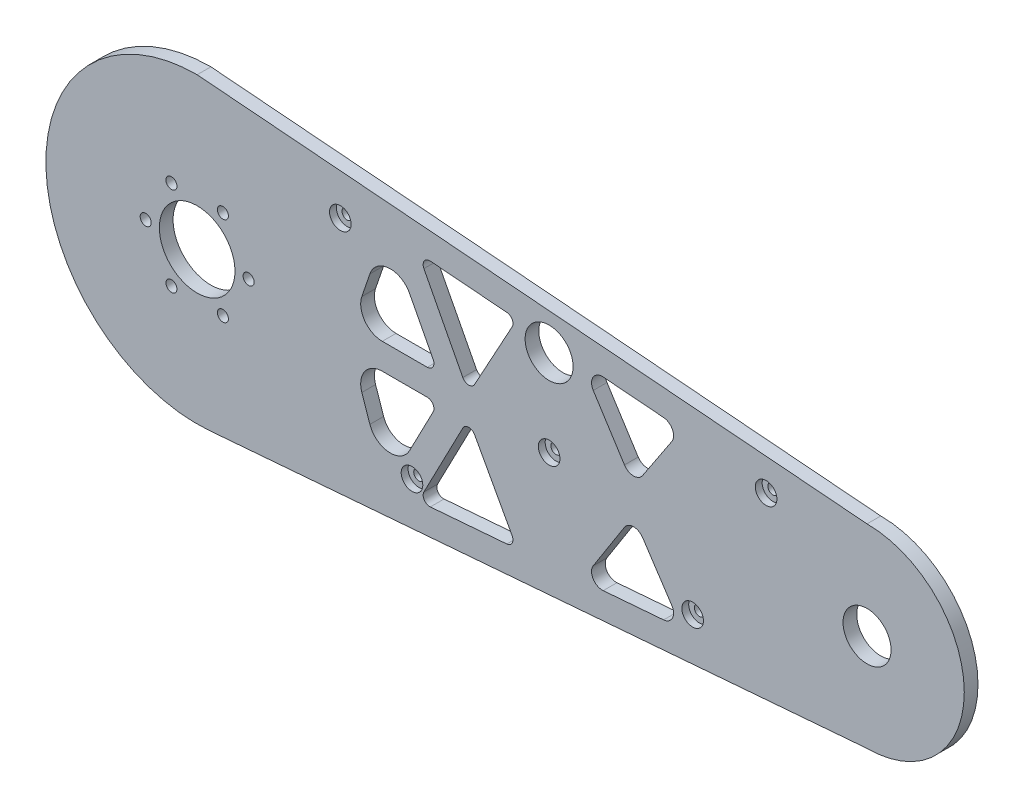
from build123d import *

# Parameters (mm, degrees)
SKETCH1_R             = 14.29385
SKETCH1_R_2           = 11.115
SKETCH1_R_3           = 11.1125
BOSS_EXTRUDE1_DEPTH   = 6.35
CROQUIS1_R            = 2.38125
CORTAR_EXTRUIR1_DEPTH = 50
CROQUIS2_R            = 5
CORTAR_EXTRUIR2_DEPTH = 3.175
CROQUIS4_R            = 5
CORTAR_EXTRUIR3_DEPTH = 3.175
CROQUIS5_R            = 2.38125
CORTAR_EXTRUIR5_DEPTH = 10
CROQUIS6_R            = 2.38125
CORTAR_EXTRUIR6_DEPTH = 10
CROQUIS7_R            = 5
CORTAR_EXTRUIR7_DEPTH = 3.17
CROQUIS8_R            = 17.5
CORTAR_EXTRUIR8_DEPTH = 10
CROQUIS9_R            = 2.5527
CORTAR_EXTRUIR9_DEPTH = 10
REDONDEO1_R           = 10
REDONDEO2_R           = 10


with BuildPart() as part:
    # Sketch1 → Boss-Extrude1 (new body)
    with BuildSketch(Plane.XY):
        with BuildLine():
            Line((0, 70), (310, 45))
            ThreePointArc((310, 45), (355, 0), (310, -45))
            Line((310, -45), (5.171398252, -69.808714643))
            ThreePointArc((5.171398252, -69.808714643), (-69.952162315, -2.587467389), (0, 70))
        make_face()
        Circle(SKETCH1_R, mode=Mode.SUBTRACT)
        with Locations((310, 0)):
            Circle(SKETCH1_R_2, mode=Mode.SUBTRACT)
        with Locations((162.878542763, 40)):
            Circle(SKETCH1_R_3, mode=Mode.SUBTRACT)
        with BuildLine():
            Line((107.898974887, 49.259511156), (143.314248041, 46.40344074))
            ThreePointArc((143.314248041, 46.40344074), (145.778687899, 44.795099511), (145.77013932, 41.85228585))
            Line((145.77013932, 41.85228585), (128.378649176, 10.066371663))
            ThreePointArc((128.378649176, 10.066371663), (125.642816195, 8.463958078), (122.941073557, 10.123204327))
            Line((122.941073557, 10.123204327), (104.917290547, 44.76518893))
            ThreePointArc((104.917290547, 44.76518893), (105.083158572, 47.891382399), (107.898974887, 49.259511156))
        make_face(mode=Mode.SUBTRACT)
        with BuildLine():
            Line((76.27981623, 6), (106.481811543, 6))
            ThreePointArc((106.481811543, 6), (109.116349872, 7.482780968), (109.215763472, 10.504295247))
            Line((109.215763472, 10.504295247), (98.275279723, 31.532071124))
            ThreePointArc((98.275279723, 31.532071124), (88.653069912, 36.888291672), (79.941746192, 30.151166228))
            Line((79.941746192, 30.151166228), (72.341894512, 7.91896567))
            ThreePointArc((72.341894512, 7.91896567), (74.089516211, 6.505271329), (76.27981623, 6))
        make_face(mode=Mode.SUBTRACT)
        with BuildLine():
            Line((219.623774494, 32.810522613), (206.130928429, 12.417497436))
            ThreePointArc((206.130928429, 12.417497436), (201.919524559, 10.176643248), (197.745901529, 12.48710226))
            Line((197.745901529, 12.48710226), (183.296864227, 35.133505128))
            ThreePointArc((183.296864227, 35.133505128), (183.227765467, 40.400743015), (187.913912204, 42.80669363))
            Line((187.913912204, 42.80669363), (215.855795571, 40.553315939))
            ThreePointArc((215.855795571, 40.553315939), (219.949772588, 37.757395035), (219.623774494, 32.810522613))
        make_face(mode=Mode.SUBTRACT)
        with BuildLine():
            Line((98.275279723, -31.532071124), (109.215763472, -10.504295247))
            ThreePointArc((109.215763472, -10.504295247), (109.116349872, -7.482780968), (106.481811543, -6))
            Line((106.481811543, -6), (76.27981623, -6))
            ThreePointArc((76.27981623, -6), (74.089516211, -6.505271329), (72.341894512, -7.91896567))
            Line((72.341894512, -7.91896567), (79.941746192, -30.151166228))
            ThreePointArc((79.941746192, -30.151166228), (88.653069912, -36.888291672), (98.275279723, -31.532071124))
        make_face(mode=Mode.SUBTRACT)
        with BuildLine():
            Line((187.913912204, -42.80669363), (215.855795571, -40.553315939))
            ThreePointArc((215.855795571, -40.553315939), (219.949772588, -37.757395035), (219.623774494, -32.810522613))
            Line((219.623774494, -32.810522613), (206.130928429, -12.417497436))
            ThreePointArc((206.130928429, -12.417497436), (201.919524559, -10.176643248), (197.745901529, -12.48710226))
            Line((197.745901529, -12.48710226), (183.296864227, -35.133505128))
            ThreePointArc((183.296864227, -35.133505128), (183.227765467, -40.400743015), (187.913912204, -42.80669363))
        make_face(mode=Mode.SUBTRACT)
        with BuildLine():
            Line((122.941073557, -10.123204327), (104.917290547, -44.76518893))
            ThreePointArc((104.917290547, -44.76518893), (105.083158572, -47.891382399), (107.898974887, -49.259511156))
            Line((107.898974887, -49.259511156), (143.314248041, -46.40344074))
            ThreePointArc((143.314248041, -46.40344074), (145.778687899, -44.795099511), (145.77013932, -41.85228585))
            Line((145.77013932, -41.85228585), (128.378649176, -10.066371663))
            ThreePointArc((128.378649176, -10.066371663), (125.642816195, -8.463958078), (122.941073557, -10.123204327))
        make_face(mode=Mode.SUBTRACT)
    extrude(amount=BOSS_EXTRUDE1_DEPTH)

    # Croquis1 → Cortar-Extruir1 (cut)
    with BuildSketch(Plane.XY.offset(6.35)):
        with Locations((99.417366651, -42.272966779)):
            Circle(CROQUIS1_R)
        with Locations((229.299162877, -31.702435007)):
            Circle(CROQUIS1_R)
    extrude(amount=-CORTAR_EXTRUIR1_DEPTH, mode=Mode.SUBTRACT)

    # Croquis2 → Cortar-Extruir2 (cut)
    with BuildSketch(Plane.XY.offset(6.35)):
        with Locations((99.417366651, -42.272966779)):
            Circle(CROQUIS2_R)
        with Locations((229.299162877, -31.702435007)):
            Circle(CROQUIS2_R)
    extrude(amount=-CORTAR_EXTRUIR2_DEPTH, mode=Mode.SUBTRACT)

    # Croquis4 → Cortar-Extruir3 (cut)
    with BuildSketch(Plane.XY.offset(6.35)):
        with Locations((162.878542763, 0)):
            Circle(CROQUIS4_R)
    extrude(amount=-CORTAR_EXTRUIR3_DEPTH, mode=Mode.SUBTRACT)

    # Croquis5 → Cortar-Extruir5 (cut)
    with BuildSketch(Plane.XY.offset(6.35)):
        with Locations((162.878542763, 0)):
            Circle(CROQUIS5_R)
    extrude(amount=-CORTAR_EXTRUIR5_DEPTH, mode=Mode.SUBTRACT)

    # Croquis6 → Cortar-Extruir6 (cut)
    with BuildSketch(Plane.XY.offset(6.35)):
        with Locations((66.263169386, 45.68611009)):
            Circle(CROQUIS6_R)
        with Locations((263.293381054, 34.027262471)):
            Circle(CROQUIS6_R)
    extrude(amount=-CORTAR_EXTRUIR6_DEPTH, mode=Mode.SUBTRACT)

    # Croquis7 → Cortar-Extruir7 (cut)
    with BuildSketch(Plane.XY.offset(6.35)):
        with Locations((66.263169386, 45.68611009)):
            Circle(CROQUIS7_R)
        with Locations((263.293381054, 34.027262471)):
            Circle(CROQUIS7_R)
    extrude(amount=-CORTAR_EXTRUIR7_DEPTH, mode=Mode.SUBTRACT)

    # Croquis8 → Cortar-Extruir8 (cut)
    with BuildSketch(Plane.XY.offset(6.35)):
        Circle(CROQUIS8_R)
    extrude(amount=-CORTAR_EXTRUIR8_DEPTH, mode=Mode.SUBTRACT)

    # Croquis9 → Cortar-Extruir9 (cut)
    with BuildSketch(Plane(origin=(0, 0, 0), x_dir=(-1, 0, 0), z_dir=(0, 0, -1))):
        with Locations((23.8125, 0)):
            Circle(CROQUIS9_R)
        with Locations((11.90625, -20.622229928)):
            Circle(CROQUIS9_R)
        with Locations((-11.90625, -20.622229928)):
            Circle(CROQUIS9_R)
        with Locations((-23.8125, 0)):
            Circle(CROQUIS9_R)
        with Locations((-11.90625, 20.622229928)):
            Circle(CROQUIS9_R)
        with Locations((11.90625, 20.622229928)):
            Circle(CROQUIS9_R)
    extrude(amount=-CORTAR_EXTRUIR9_DEPTH, mode=Mode.SUBTRACT)

    # Redondeo1
    redondeo1_edges = [part.edges().sort_by_distance(p)[0] for p in [
        (72.341894512, -7.91896567, 3.175),
    ]]
    fillet(redondeo1_edges, radius=REDONDEO1_R)

    # Redondeo2
    redondeo2_edges = [part.edges().sort_by_distance(p)[0] for p in [
        (72.341894512, 7.91896567, 3.175),
    ]]
    fillet(redondeo2_edges, radius=REDONDEO2_R)


solid = part.part
